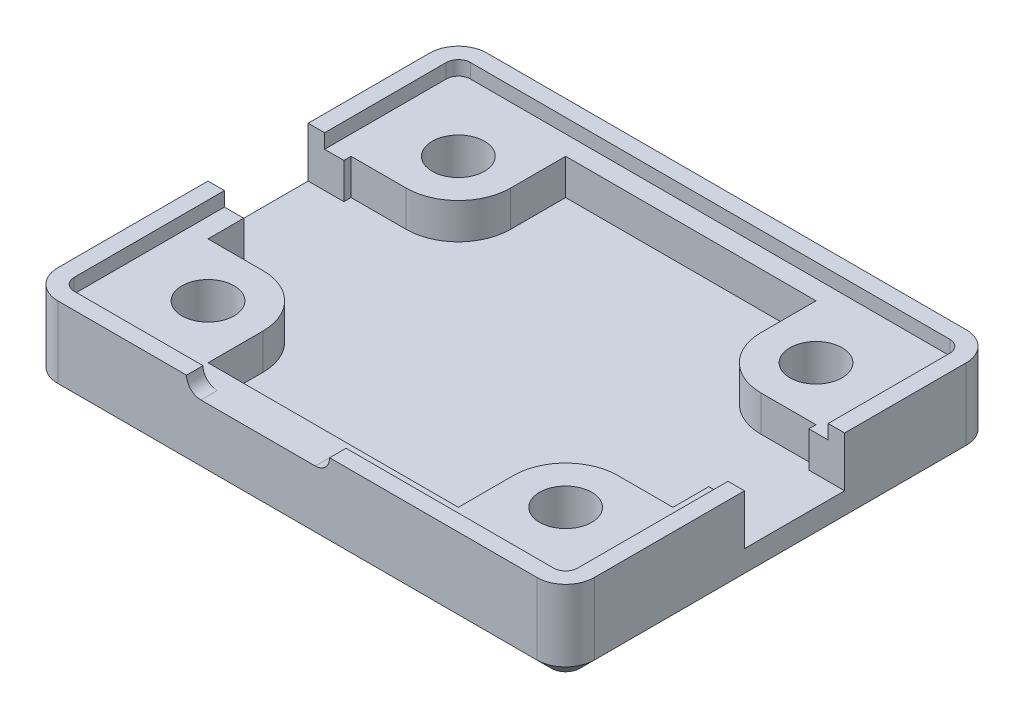
from build123d import *

# Parameters (mm, degrees)
BOSS_EXTRUDE1_DEPTH = 6
SKETCH2_R           = 1.825
CUT_EXTRUDE3_DEPTH  = 3.5
SKETCH3_R           = 1.825
CUT_EXTRUDE4_DEPTH  = 13.5
SKETCH4_W           = 32.5
SKETCH4_H           = 25
CUT_EXTRUDE5_DEPTH  = 1
SKETCH5_W           = 2.5
SKETCH5_H           = 7
CUT_EXTRUDE6_DEPTH  = 3.5
CUT_EXTRUDE7_DEPTH  = 1
FILLET1_R           = 3.65
CHAMFER1_SIZE       = 1
CUT_EXTRUDE8_DEPTH  = 10


with BuildPart() as part:
    # Sketch1 → Boss-Extrude1 (new body)
    with BuildSketch(Plane(origin=(0, 0, 0), x_dir=(1, 0, 0), z_dir=(0, 1, 0))):
        with BuildLine():
            Line((-16.75, -15), (16.75, -15))
            ThreePointArc((16.75, -15), (18.164213562, -14.414213562), (18.75, -13))
            Line((18.75, -13), (18.75, 13))
            ThreePointArc((18.75, 13), (18.164213562, 14.414213562), (16.75, 15))
            Line((16.75, 15), (-16.75, 15))
            ThreePointArc((-16.75, 15), (-18.164213562, 14.414213562), (-18.75, 13))
            Line((-18.75, 13), (-18.75, -13))
            ThreePointArc((-18.75, -13), (-18.164213562, -14.414213562), (-16.75, -15))
        make_face()
    extrude(amount=BOSS_EXTRUDE1_DEPTH)

    # Sketch2 → Cut-Extrude3 (cut)
    with BuildSketch(Plane(origin=(0, 6, 0), x_dir=(1, 0, 0), z_dir=(0, 1, 0))):
        Polygon((8.75, 12.5), (-8.75, 12.5), (-8.75, 5), (-16.25, 5), (-16.25, -5), (-8.75, -5), (-8.75, -12.5), (8.75, -12.5), (8.75, -5), (16.25, -5), (16.25, 5), (8.75, 5), align=None)
        with Locations((-12.5, 8.75)):
            Circle(SKETCH2_R)
        with Locations((12.5, 8.75)):
            Circle(SKETCH2_R)
        with Locations((12.5, -8.75)):
            Circle(SKETCH2_R)
        with Locations((-12.5, -8.75)):
            Circle(SKETCH2_R)
    extrude(amount=-CUT_EXTRUDE3_DEPTH, mode=Mode.SUBTRACT)

    # Sketch3 → Cut-Extrude4 (cut)
    with BuildSketch(Plane(origin=(0, 6, 0), x_dir=(1, 0, 0), z_dir=(0, 1, 0))):
        with Locations((-12.5, 8.75)):
            Circle(SKETCH3_R)
        with Locations((-12.5, -8.75)):
            Circle(SKETCH3_R)
        with Locations((12.5, -8.75)):
            Circle(SKETCH3_R)
        with Locations((12.5, 8.75)):
            Circle(SKETCH3_R)
    extrude(amount=-CUT_EXTRUDE4_DEPTH, mode=Mode.SUBTRACT)

    # Sketch4 → Cut-Extrude5 (cut)
    with BuildSketch(Plane(origin=(0, 6, 0), x_dir=(1, 0, 0), z_dir=(0, 1, 0))):
        Rectangle(SKETCH4_W, SKETCH4_H)
    extrude(amount=-CUT_EXTRUDE5_DEPTH, mode=Mode.SUBTRACT)

    # Sketch5 → Cut-Extrude6 (cut)
    with BuildSketch(Plane(origin=(0, 6, 0), x_dir=(1, 0, 0), z_dir=(0, 1, 0))):
        with Locations((-17.5, 1)):
            Rectangle(SKETCH5_W, SKETCH5_H)
        with Locations((17.5, 1)):
            Rectangle(SKETCH5_W, SKETCH5_H)
    extrude(amount=-CUT_EXTRUDE6_DEPTH, mode=Mode.SUBTRACT)

    # Sketch6 → Cut-Extrude7 (cut)
    with BuildSketch(Plane(origin=(0, 6, 0), x_dir=(1, 0, 0), z_dir=(0, 1, 0))):
        with BuildLine():
            Line((16.25, 4.5), (17.6, 4.5))
            Line((17.6, 4.5), (17.6, 13))
            ThreePointArc((17.6, 13), (17.351040764, 13.601040764), (16.75, 13.85))
            Line((16.75, 13.85), (-16.75, 13.85))
            ThreePointArc((-16.75, 13.85), (-17.351040764, 13.601040764), (-17.6, 13))
            Line((-17.6, 13), (-17.6, 4.5))
            Line((-17.6, 4.5), (-16.25, 4.5))
            Line((-16.25, 4.5), (-16.25, 12.5))
            Line((-16.25, 12.5), (16.25, 12.5))
            Line((16.25, 12.5), (16.25, 4.5))
        make_face()
        with BuildLine():
            Line((-17.6, -2.5), (-17.6, -13))
            ThreePointArc((-17.6, -13), (-17.351040764, -13.601040764), (-16.75, -13.85))
            Line((-16.75, -13.85), (16.75, -13.85))
            ThreePointArc((16.75, -13.85), (17.351040764, -13.601040764), (17.6, -13))
            Line((17.6, -13), (17.6, -2.5))
            Line((17.6, -2.5), (16.25, -2.5))
            Line((16.25, -2.5), (16.25, -12.5))
            Line((16.25, -12.5), (-16.25, -12.5))
            Line((-16.25, -12.5), (-16.25, -2.5))
            Line((-16.25, -2.5), (-17.6, -2.5))
        make_face()
    extrude(amount=-CUT_EXTRUDE7_DEPTH, mode=Mode.SUBTRACT)

    # Fillet1
    fillet1_edges = [part.edges().sort_by_distance(p)[0] for p in [
        (8.75, 3.75, 5),
        (-8.75, 3.75, 5),
        (8.75, 3.75, -5),
        (-8.75, 3.75, -5),
    ]]
    fillet(fillet1_edges, radius=FILLET1_R)

    # Chamfer1
    chamfer1_edges = [part.edges().sort_by_distance(p)[0] for p in [
        (18.75, 0, 0),
        (18.164213562, 0, -14.414213562),
        (18.164213562, 0, 14.414213562),
        (0, 0, -15),
        (0, 0, 15),
        (-18.164213562, 0, -14.414213562),
        (-18.164213562, 0, 14.414213562),
        (-18.75, 0, 0),
    ]]
    chamfer(chamfer1_edges, length=CHAMFER1_SIZE)

    # Sketch7 → Cut-Extrude8 (cut)
    with BuildSketch(Plane.XY.offset(15)):
        with BuildLine():
            Line((-6.75, 7), (1.25, 7))
            ThreePointArc((1.25, 7), (2.25, 6), (1.25, 5))
            Line((1.25, 5), (-6.75, 5))
            ThreePointArc((-6.75, 5), (-7.75, 6), (-6.75, 7))
        make_face()
    extrude(amount=-CUT_EXTRUDE8_DEPTH, mode=Mode.SUBTRACT)


solid = part.part
